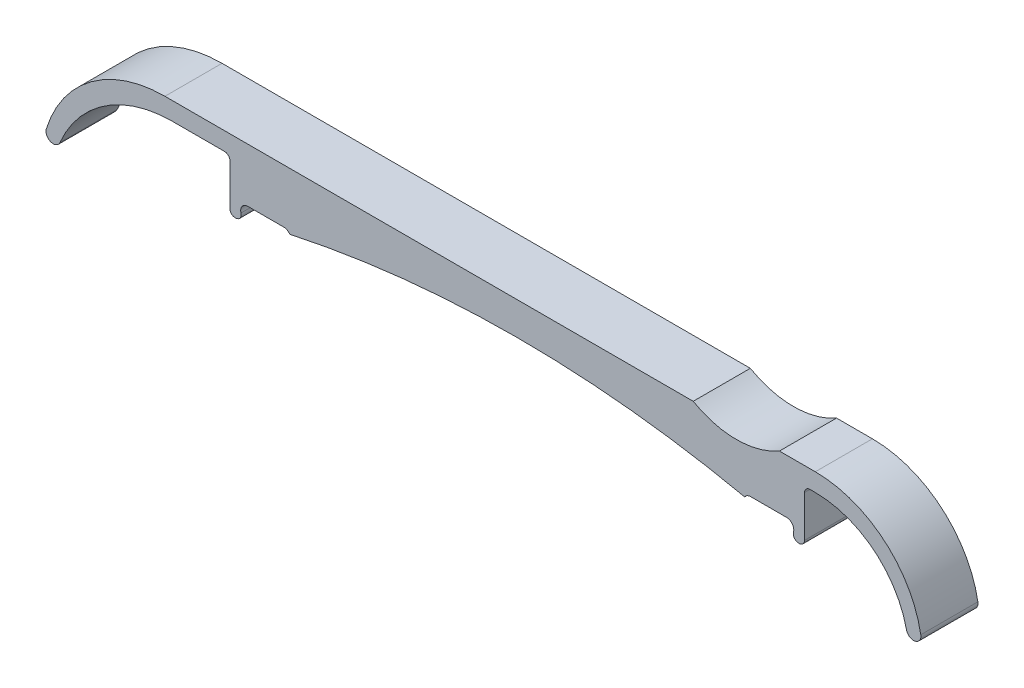
from build123d import *

# Parameters (mm, degrees)
EXTRUDE_1210_DEPTH     = 7.95
CUT_EXTRUDE_1739_DEPTH = 87.052353761
FILLET_1_R             = 0.75
CUT_EXTRUDE_3017_DEPTH = 87.052353882
FILLET_START           = -9
FILLET_2_DEPTH         = 10
FILLET_3_DEPTH         = 10


with BuildPart() as part:
    # Эскиз1 → Extrude 1210 (new body)
    with BuildSketch(Plane.XY):
        with BuildLine():
            Line((-59.003125249, 1.5), (-59.003125249, 9))
            Line((-59.003125249, 9), (-67.003125249, 9))
            ThreePointArc((-67.003125249, 9), (-76.672665052, 5.982131454), (-82.909098969, -2))
            Line((-82.909098969, -2), (-84.909098969, -2))
            ThreePointArc((-84.909098969, -2), (-78.847334249, 7.709212734), (-68.047161318, 11.5))
            Line((-68.047161318, 11.5), (0, 11.5))
            Line((0, 11.5), (22.496874751, 11.5))
            ThreePointArc((22.496874751, 11.5), (32.529707481, 7.620316306), (37.34210733, -2))
            Line((37.34210733, -2), (35.34210733, -2))
            ThreePointArc((35.34210733, -2), (30.952642014, 5.874208829), (22.496874751, 9))
            Line((22.496874751, 9), (20.996874751, 9))
            Line((20.996874751, 9), (20.996874751, 1.5))
            ThreePointArc((20.996874751, 1.5), (-19.003125249, 6.931677052), (-59.003125249, 1.5))
        make_face()
    extrude(amount=-EXTRUDE_1210_DEPTH)

    # Эскиз5 → Cut-Extrude 1739 (cut, through all)
    with BuildSketch(Plane.XY):
        with BuildLine():
            Line((-56.503125249, 4), (-51.503125249, 4))
            ThreePointArc((-51.503125249, 4), (-50.503125249, 3), (-51.503125249, 2))
            Line((-51.503125249, 2), (-56.503125249, 2))
            ThreePointArc((-56.503125249, 2), (-57.503125249, 3), (-56.503125249, 4))
        make_face()
        with BuildLine():
            Line((18.496874751, 2), (13.496874751, 2))
            ThreePointArc((13.496874751, 2), (12.496874751, 3), (13.496874751, 4))
            Line((13.496874751, 4), (18.496874751, 4))
            ThreePointArc((18.496874751, 4), (19.496874751, 3), (18.496874751, 2))
        make_face()
    extrude(amount=-CUT_EXTRUDE_1739_DEPTH, mode=Mode.SUBTRACT)

    # Скругление1
    fillet_1_edges = [part.edges().sort_by_distance(p)[0] for p in [
        (-59.003125249, 1.5, -3.975),
        (-59.003125249, 9, -3.975),
        (20.996874751, 9, -3.975),
        (20.996874751, 1.5, -3.975),
        (-56.87546785, 2.071904645, -3.975),
        (18.869217353, 2.071904645, -3.975),
    ]]
    fillet(fillet_1_edges, radius=FILLET_1_R)

    # Эскиз3 → Cut-Extrude 3017 (cut, through all)
    with BuildSketch(Plane.XY):
        with BuildLine():
            Line((5.5, 11.5), (17.5, 11.5))
            ThreePointArc((17.5, 11.5), (11.5, 9.892304845), (5.5, 11.5))
        make_face()
    extrude(amount=-CUT_EXTRUDE_3017_DEPTH, mode=Mode.SUBTRACT)

    # Скругление2: read off the stored shape, not the designer's step
    # Скругление2 outline → Скругление2 (cut)
    with BuildSketch(Plane.XY.offset(FILLET_START)):
        with BuildLine():
            add(Edge.make_bspline(
                [(-83.594065856, -1.999999999), (-83.128693054, -2), (-82.805959239, -1.722499415), (-82.662093068, -1.382090449)],
                knots=[0.592824962, 0.592824962, 0.592824962, 0.592824962, 1, 1, 1, 1], degree=3, weights=[0.541566314, 0.5894209, 0.742232129, 1]))
            Line((-83.594065856, -1.999999999), (-82.909098969, -2))
            ThreePointArc((-82.909098969, -2), (-82.78861975, -1.689836505), (-82.662093068, -1.382090449))
        make_face()
        with BuildLine():
            add(Edge.make_bspline(
                [(-84.560958648, -0.690168037), (-84.749276161, -1.301091768), (-84.44037433, -1.999999997), (-83.594065856, -1.999999999)],
                knots=[0, 0, 0, 0, 0.592824962, 0.592824962, 0.592824962, 0.592824962], degree=3, weights=[1, 0.624703839, 0.47189261, 0.541566314]))
            ThreePointArc((-84.560958648, -0.690168037), (-84.747874965, -1.341669638), (-84.909098969, -2))
            Line((-84.909098969, -2), (-83.594065856, -1.999999999))
        make_face()
    extrude(amount=FILLET_2_DEPTH, mode=Mode.SUBTRACT)

    # Скругление3: read off the stored shape, not the designer's step
    # Скругление3 outline → Скругление3 (cut)
    with BuildSketch(Plane.XY.offset(FILLET_START)):
        with BuildLine():
            add(Edge.make_bspline(
                [(36.182438008, -1.999999999), (36.957978226, -1.999999999), (37.281497294, -1.380826049), (37.180278652, -0.809748442)],
                knots=[0.449797355, 0.449797355, 0.449797355, 0.449797355, 1, 1, 1, 1], degree=3, weights=[0.515263178, 0.479194979, 0.64077392, 1]))
            Line((36.182438008, -1.999999999), (37.34210733, -2))
            ThreePointArc((37.34210733, -2), (37.273182402, -1.40324412), (37.180278652, -0.809748442))
        make_face()
        with BuildLine():
            add(Edge.make_bspline(
                [(35.192752533, -1.204523772), (35.28524719, -1.624595617), (35.624720765, -1.999999999), (36.182438008, -1.999999999)],
                knots=[0, 0, 0, 0, 0.449797355, 0.449797355, 0.449797355, 0.449797355], degree=3, weights=[1, 0.70632831, 0.544749369, 0.515263178]))
            ThreePointArc((35.192752533, -1.204523772), (35.273622194, -1.601099256), (35.34210733, -2))
            Line((35.34210733, -2), (36.182438008, -1.999999999))
        make_face()
    extrude(amount=FILLET_3_DEPTH, mode=Mode.SUBTRACT)


solid = part.part
